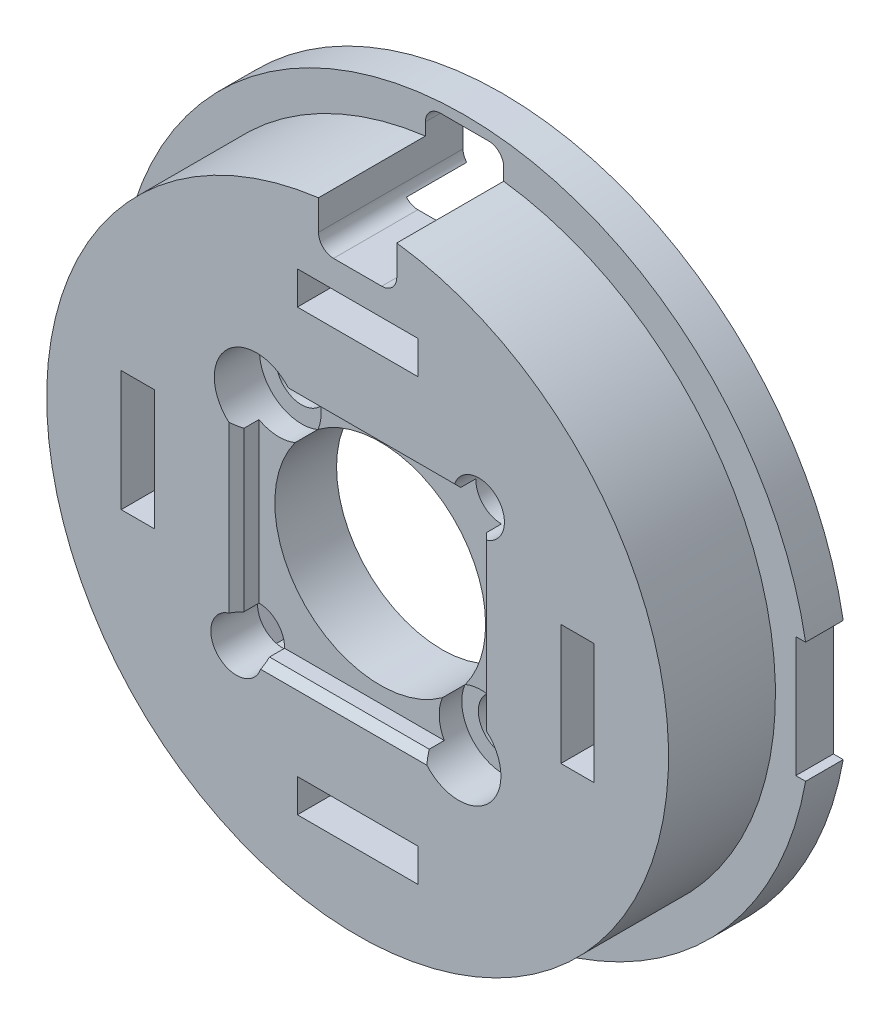
from build123d import *

# Parameters (mm, degrees)
SKETCH_1_R               = 17.4
EXTRUDE_1_DEPTH          = 5.6
SKETCH_2_R               = 1.7
CUT_EXTRUDE_1_DEPTH      = 26.23648153
SKETCH_3_R               = 7
CUT_EXTRUDE_2_DEPTH      = 26.23648153
SKETCH_4_R               = 2.8
CUT_EXTRUDE_3_DEPTH      = 3
SKETCH_5_R               = 1.7
CUT_EXTRUDE_4_DEPTH      = 26.23648153
CUT_EXTRUDE_5_DEPTH      = 2.5
SKETCH_7_W               = 16.1
SKETCH_7_H               = 16.1
CUT_EXTRUDE_6_DEPTH      = 1.5
CHAMFER_1_SIZE           = 0.5
SKETCH_9_W               = 2.2
SKETCH_9_H               = 8
SKETCH_9_W_2             = 8
SKETCH_9_H_2             = 2.2
CUT_EXTRUDE_7_DEPTH      = 26.281613873
BOSS_EXTRUDE1_DEPTH      = 5.6
BOSS_EXTRUDE1_DEPTH_BACK = 4
SKETCH1_R                = 20.65
SKETCH1_R_2              = 17.4
SKETCH3_R                = 23
SKETCH3_R_2              = 20.65
BOSS_EXTRUDE2_DEPTH      = 2.5
SKETCH4_R                = 18
CUT_EXTRUDE3_DEPTH       = 4
SKETCH5_W                = 1
SKETCH5_H                = 8
CUT_EXTRUDE4_DEPTH       = 10
CUT_EXTRUDE6_DEPTH       = 10
FILLET3_R                = 1


with BuildPart() as part:
    # 草图1 → 凸台-拉伸1 (new body)
    with BuildSketch(Plane.XY):
        Circle(SKETCH_1_R)
    extrude(amount=EXTRUDE_1_DEPTH)

    # 草图2 → 切除-拉伸1 (cut, through all)
    with BuildSketch(Plane.XY.offset(5.6)):
        with Locations((-6.717514421, 6.717514421)):
            Circle(SKETCH_2_R)
        with Locations((6.717514421, -6.717514421)):
            Circle(SKETCH_2_R)
    extrude(amount=-CUT_EXTRUDE_1_DEPTH, mode=Mode.SUBTRACT)

    # 草图3 → 切除-拉伸2 (cut, through all)
    with BuildSketch(Plane.XY.offset(5.6)):
        Circle(SKETCH_3_R)
    extrude(amount=-CUT_EXTRUDE_2_DEPTH, mode=Mode.SUBTRACT)

    # 草图4 → 切除-拉伸3 (cut)
    with BuildSketch(Plane.XY.offset(5.6)):
        with Locations((-6.717514421, 6.717514421)):
            Circle(SKETCH_4_R)
        with Locations((6.717514421, -6.717514421)):
            Circle(SKETCH_4_R)
    extrude(amount=-CUT_EXTRUDE_3_DEPTH, mode=Mode.SUBTRACT)

    # 草图5 → 切除-拉伸4 (cut, through all)
    with BuildSketch(Plane.XY.offset(5.6)):
        with Locations((8.05, 8)):
            Circle(SKETCH_5_R)
        with Locations((-8.05, -8)):
            Circle(SKETCH_5_R)
    extrude(amount=-CUT_EXTRUDE_4_DEPTH, mode=Mode.SUBTRACT)

    # 草图6 → 切除-拉伸5 (cut)
    with BuildSketch(Plane(origin=(0, 0, 0), x_dir=(-1, 0, 0), z_dir=(0, 0, -1))):
        Polygon((4.766838493, -8), (6.408419246, -10.84330127), (9.691580754, -10.84330127), (11.333161507, -8), (9.691580754, -5.15669873), (6.408419246, -5.15669873), align=None)
        Polygon((-4.766838493, 8), (-6.408419246, 10.84330127), (-9.691580754, 10.84330127), (-11.333161507, 8), (-9.691580754, 5.15669873), (-6.408419246, 5.15669873), align=None)
    extrude(amount=-CUT_EXTRUDE_5_DEPTH, mode=Mode.SUBTRACT)

    # 草图7 → 切除-拉伸6 (cut)
    with BuildSketch(Plane.XY.offset(5.6)):
        Rectangle(SKETCH_7_W, SKETCH_7_H)
    extrude(amount=-CUT_EXTRUDE_6_DEPTH, mode=Mode.SUBTRACT)

    # 倒角1
    chamfer_1_edges = [part.edges().sort_by_distance(p)[0] for p in [
        (8.05, 1.022551258, 5.6),
        (1.047918985, 8.05, 5.6),
        (-8.05, -1.022551258, 5.6),
        (-1.047918985, -8.05, 5.6),
    ]]
    chamfer(chamfer_1_edges, length=CHAMFER_1_SIZE)

    # 草图8 → 旋转1 (revolve)
    with BuildSketch(Plane(origin=(0, 0, 0), x_dir=(0, 0, -1), z_dir=(1, 0, 0)), mode=Mode.PRIVATE) as revolve_1_sk:
        Polygon((0, 17.4), (0, 17.2), (0.2, 17.4), align=None)
    revolve(revolve_1_sk.sketch.rotate(Axis((0, 0, 0), (0, 0, 1)), 90), axis=Axis((0, 0, 0), (0, 0, 1)))

    # 草图9 → 切除-拉伸7 (cut, through all)
    with BuildSketch(Plane.XY.offset(5.6)):
        with Locations((14.6, 0)):
            Rectangle(SKETCH_9_W, SKETCH_9_H)
        with Locations((0, 14.6)):
            Rectangle(SKETCH_9_W_2, SKETCH_9_H_2)
        with Locations((-14.6, 0)):
            Rectangle(SKETCH_9_W, SKETCH_9_H)
        with Locations((0, -14.6)):
            Rectangle(SKETCH_9_W_2, SKETCH_9_H_2)
    extrude(amount=-CUT_EXTRUDE_7_DEPTH, mode=Mode.SUBTRACT)

    # Sketch1 → Boss-Extrude1 (add, two sides: drawn at the far end of the back side and taken through both)
    with BuildSketch(Plane.XY.offset(-BOSS_EXTRUDE1_DEPTH_BACK)):
        Circle(SKETCH1_R)
        Circle(SKETCH1_R_2, mode=Mode.SUBTRACT)
    extrude(amount=BOSS_EXTRUDE1_DEPTH + BOSS_EXTRUDE1_DEPTH_BACK)

    # Sketch3 → Boss-Extrude2 (add)
    with BuildSketch(Plane(origin=(0, 0, -4), x_dir=(-1, 0, 0), z_dir=(0, 0, -1))):
        Circle(SKETCH3_R)
        with Locations(Location((0, 0, 0), (0, 0, 180))):
            Circle(SKETCH3_R_2, mode=Mode.SUBTRACT)
    extrude(amount=-BOSS_EXTRUDE2_DEPTH)

    # Sketch4 → Cut-Extrude3 (cut)
    with BuildSketch(Plane(origin=(0, 0, -4), x_dir=(-1, 0, 0), z_dir=(0, 0, -1))):
        Circle(SKETCH4_R)
    extrude(amount=-CUT_EXTRUDE3_DEPTH, mode=Mode.SUBTRACT)

    # Sketch5 → Cut-Extrude4 (cut)
    with BuildSketch(Plane(origin=(0, 0, -4), x_dir=(-1, 0, 0), z_dir=(0, 0, -1))):
        with Locations((22.5, 0)):
            Rectangle(SKETCH5_W, SKETCH5_H)
        with Locations((-22.5, 0)):
            Rectangle(SKETCH5_W, SKETCH5_H)
    extrude(amount=-CUT_EXTRUDE4_DEPTH, mode=Mode.SUBTRACT)

    # Sketch7 → Cut-Extrude6 (cut)
    with BuildSketch(Plane(origin=(0, 0, -4), x_dir=(-1, 0, 0), z_dir=(0, 0, -1))):
        with BuildLine():
            Line((0, 18), (0, 22.3))
            Line((0, 22.3), (-2.6, 22.3))
            Line((-2.6, 22.3), (-2.6, 17.811232411))
            ThreePointArc((-2.6, 17.811232411), (-1.303421766, 17.952746077), (0, 18))
        make_face()
        with BuildLine():
            Line((0, 17.5), (0, 18))
            ThreePointArc((0, 18), (-1.303421766, 17.952746077), (-2.6, 17.811232411))
            Line((-2.6, 17.811232411), (-2.6, 17.5))
            Line((-2.6, 17.5), (0, 17.5))
        make_face()
        with BuildLine():
            Line((2.6, 22.3), (0, 22.3))
            Line((0, 22.3), (0, 18))
            ThreePointArc((0, 18), (1.303421766, 17.952746077), (2.6, 17.811232411))
            Line((2.6, 17.811232411), (2.6, 22.3))
        make_face()
        with BuildLine():
            ThreePointArc((2.6, 17.811232411), (1.303421766, 17.952746077), (0, 18))
            Line((0, 18), (0, 17.5))
            Line((0, 17.5), (2.6, 17.5))
            Line((2.6, 17.5), (2.6, 17.811232411))
        make_face()
    extrude(amount=-CUT_EXTRUDE6_DEPTH, mode=Mode.SUBTRACT)

    # Fillet3
    # the kernel refuses this fillet: 1 mm, written as the material it adds along each edge
    with BuildSketch(Plane(origin=(2.6, 22.3, -4), x_dir=(-1, 0, 0), z_dir=(0, 0, 1))) as fillet3_piece_1:
        with BuildLine():
            CenterArc((FILLET3_R, FILLET3_R), FILLET3_R, 180, 90)
            Line((0, FILLET3_R), (-FILLET3_R * 0.02, FILLET3_R))
            Line((-FILLET3_R * 0.02, FILLET3_R), (-FILLET3_R * 0.02, -FILLET3_R * 0.02))
            Line((-FILLET3_R * 0.02, -FILLET3_R * 0.02), (FILLET3_R, -FILLET3_R * 0.02))
            Line((FILLET3_R, -FILLET3_R * 0.02), (FILLET3_R, 0))
        make_face()
    extrude(amount=2.5)
    with BuildSketch(Plane(origin=(-2.6, 22.3, -4), x_dir=(1, 0, 0), z_dir=(0, 0, 1))) as fillet3_piece_2:
        with BuildLine():
            CenterArc((FILLET3_R, -FILLET3_R), FILLET3_R, 90, 90)
            Line((0, -FILLET3_R), (-FILLET3_R * 0.02, -FILLET3_R))
            Line((-FILLET3_R * 0.02, -FILLET3_R), (-FILLET3_R * 0.02, FILLET3_R * 0.02))
            Line((-FILLET3_R * 0.02, FILLET3_R * 0.02), (FILLET3_R, FILLET3_R * 0.02))
            Line((FILLET3_R, FILLET3_R * 0.02), (FILLET3_R, 0))
        make_face()
    extrude(amount=2.5)
    with BuildSketch(Plane(origin=(-2.6, 17.5, -6), x_dir=(0, 1, 0), z_dir=(0, 0, 1))) as fillet3_piece_3_section:
        with BuildLine():
            CenterArc((FILLET3_R, -FILLET3_R), FILLET3_R, 90, 90)
            Line((0, -FILLET3_R), (-FILLET3_R * 0.02, -FILLET3_R))
            Line((-FILLET3_R * 0.02, -FILLET3_R), (-FILLET3_R * 0.02, FILLET3_R * 0.02))
            Line((-FILLET3_R * 0.02, FILLET3_R * 0.02), (FILLET3_R, FILLET3_R * 0.02))
            Line((FILLET3_R, FILLET3_R * 0.02), (FILLET3_R, 0))
        make_face()
    fillet3_piece_3 = extrude(amount=11.6, mode=Mode.PRIVATE)
    fillet3_piece_3 = split(fillet3_piece_3, bisect_by=Plane(origin=(-2.544482942, 18.024809788, 0), z_dir=(0, 0, -1)), keep=Keep.TOP, mode=Mode.PRIVATE)
    fillet3_piece_3 = fillet3_piece_3 - Plane(origin=(0, 0, -2), x_dir=(-1, 0, 0), z_dir=(0, 0, -1)) * Cylinder(18, 28, mode=Mode.PRIVATE)
    fillet3_piece_3 = split(fillet3_piece_3, bisect_by=Plane(origin=(-2.544482942, 18.024809788, -4), z_dir=(0, 0, 1)), keep=Keep.TOP, mode=Mode.PRIVATE)
    add(fillet3_piece_3)
    with BuildSketch(Plane(origin=(-2.6, 17.5, 0), x_dir=(0, 1, 0), z_dir=(0, 0, 1))) as fillet3_piece_4_section:
        with BuildLine():
            CenterArc((FILLET3_R, -FILLET3_R), FILLET3_R, 90, 90)
            Line((0, -FILLET3_R), (-FILLET3_R * 0.02, -FILLET3_R))
            Line((-FILLET3_R * 0.02, -FILLET3_R), (-FILLET3_R * 0.02, FILLET3_R * 0.02))
            Line((-FILLET3_R * 0.02, FILLET3_R * 0.02), (FILLET3_R, FILLET3_R * 0.02))
            Line((FILLET3_R, FILLET3_R * 0.02), (FILLET3_R, 0))
        make_face()
    fillet3_piece_4 = extrude(amount=5.6, mode=Mode.PRIVATE)
    fillet3_piece_4 = fillet3_piece_4 - Plane(origin=(0, 0, 2.8), x_dir=(-1, 0, 0), z_dir=(0, 0, -1)) * Cylinder(18, 16, mode=Mode.PRIVATE)
    add(fillet3_piece_4)
    with BuildSketch(Plane(origin=(-2.6, 17.5, 0), x_dir=(0, 1, 0), z_dir=(0, 0, 1))) as fillet3_piece_5_section:
        with BuildLine():
            CenterArc((FILLET3_R, -FILLET3_R), FILLET3_R, 90, 90)
            Line((0, -FILLET3_R), (-FILLET3_R * 0.02, -FILLET3_R))
            Line((-FILLET3_R * 0.02, -FILLET3_R), (-FILLET3_R * 0.02, FILLET3_R * 0.02))
            Line((-FILLET3_R * 0.02, FILLET3_R * 0.02), (FILLET3_R, FILLET3_R * 0.02))
            Line((FILLET3_R, FILLET3_R * 0.02), (FILLET3_R, 0))
        make_face()
    fillet3_piece_5 = extrude(amount=5.6, mode=Mode.PRIVATE)
    fillet3_piece_5 = fillet3_piece_5 & Plane(origin=(0, 0, 2.8), x_dir=(-1, 0, 0), z_dir=(0, 0, -1)) * Cylinder(18, 16, mode=Mode.PRIVATE)
    add(fillet3_piece_5)
    with BuildSketch(Plane(origin=(2.6, 17.5, -6), x_dir=(-1, 0, 0), z_dir=(0, 0, 1))) as fillet3_piece_6_section:
        with BuildLine():
            CenterArc((FILLET3_R, -FILLET3_R), FILLET3_R, 90, 90)
            Line((0, -FILLET3_R), (-FILLET3_R * 0.02, -FILLET3_R))
            Line((-FILLET3_R * 0.02, -FILLET3_R), (-FILLET3_R * 0.02, FILLET3_R * 0.02))
            Line((-FILLET3_R * 0.02, FILLET3_R * 0.02), (FILLET3_R, FILLET3_R * 0.02))
            Line((FILLET3_R, FILLET3_R * 0.02), (FILLET3_R, 0))
        make_face()
    fillet3_piece_6 = extrude(amount=11.6, mode=Mode.PRIVATE)
    fillet3_piece_6 = split(fillet3_piece_6, bisect_by=Plane(origin=(2.544482942, 18.024809788, 0), z_dir=(0, 0, -1)), keep=Keep.TOP, mode=Mode.PRIVATE)
    fillet3_piece_6 = fillet3_piece_6 - Plane(origin=(0, 0, -2), x_dir=(-1, 0, 0), z_dir=(0, 0, -1)) * Cylinder(18, 28, mode=Mode.PRIVATE)
    fillet3_piece_6 = split(fillet3_piece_6, bisect_by=Plane(origin=(2.544482942, 18.024809788, -4), z_dir=(0, 0, 1)), keep=Keep.TOP, mode=Mode.PRIVATE)
    add(fillet3_piece_6)
    with BuildSketch(Plane(origin=(2.6, 17.5, 0), x_dir=(-1, 0, 0), z_dir=(0, 0, 1))) as fillet3_piece_7_section:
        with BuildLine():
            CenterArc((FILLET3_R, -FILLET3_R), FILLET3_R, 90, 90)
            Line((0, -FILLET3_R), (-FILLET3_R * 0.02, -FILLET3_R))
            Line((-FILLET3_R * 0.02, -FILLET3_R), (-FILLET3_R * 0.02, FILLET3_R * 0.02))
            Line((-FILLET3_R * 0.02, FILLET3_R * 0.02), (FILLET3_R, FILLET3_R * 0.02))
            Line((FILLET3_R, FILLET3_R * 0.02), (FILLET3_R, 0))
        make_face()
    fillet3_piece_7 = extrude(amount=5.6, mode=Mode.PRIVATE)
    fillet3_piece_7 = fillet3_piece_7 & Plane(origin=(0, 0, 2.8), x_dir=(-1, 0, 0), z_dir=(0, 0, -1)) * Cylinder(18, 16, mode=Mode.PRIVATE)
    add(fillet3_piece_7)
    with BuildSketch(Plane(origin=(2.6, 17.5, 0), x_dir=(-1, 0, 0), z_dir=(0, 0, 1))) as fillet3_piece_8_section:
        with BuildLine():
            CenterArc((FILLET3_R, -FILLET3_R), FILLET3_R, 90, 90)
            Line((0, -FILLET3_R), (-FILLET3_R * 0.02, -FILLET3_R))
            Line((-FILLET3_R * 0.02, -FILLET3_R), (-FILLET3_R * 0.02, FILLET3_R * 0.02))
            Line((-FILLET3_R * 0.02, FILLET3_R * 0.02), (FILLET3_R, FILLET3_R * 0.02))
            Line((FILLET3_R, FILLET3_R * 0.02), (FILLET3_R, 0))
        make_face()
    fillet3_piece_8 = extrude(amount=5.6, mode=Mode.PRIVATE)
    fillet3_piece_8 = fillet3_piece_8 - Plane(origin=(0, 0, 2.8), x_dir=(-1, 0, 0), z_dir=(0, 0, -1)) * Cylinder(18, 16, mode=Mode.PRIVATE)
    add(fillet3_piece_8)


solid = part.part
